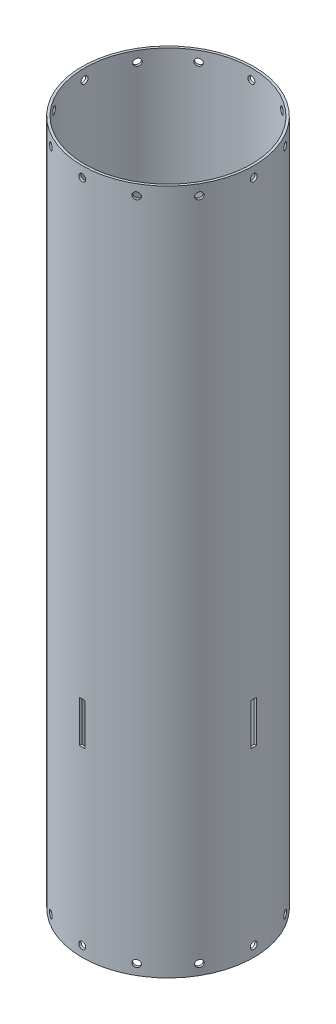
from build123d import *

# Parameters (mm, degrees)
SKETCH1_R           = 78.359
SKETCH1_R_2         = 76.2
BOSS_EXTRUDE1_DEPTH = 626.11
SKETCH2_R           = 3.175
CUT_EXTRUDE1_DEPTH  = 636.841173456
CIRPATTERN1_COUNT   = 12
SKETCH3_W           = 5.08
SKETCH3_H           = 38.1
CUT_EXTRUDE2_DEPTH  = 636.841173579
CIRPATTERN2_COUNT   = 4


with BuildPart() as part:
    # Sketch1 → Boss-Extrude1 (new body)
    with BuildSketch(Plane(origin=(0, 0, 0), x_dir=(1, 0, 0), z_dir=(0, 1, 0))):
        Circle(SKETCH1_R)
        Circle(SKETCH1_R_2, mode=Mode.SUBTRACT)
    extrude(amount=BOSS_EXTRUDE1_DEPTH)

    # Sketch2 → Cut-Extrude1 (cut, through all)
    with BuildSketch(Plane.XY):
        with Locations((0, 9.525)):
            Circle(SKETCH2_R)
        with Locations((0, 616.585)):
            Circle(SKETCH2_R)
    cut_extrude1 = extrude(amount=-CUT_EXTRUDE1_DEPTH, mode=Mode.SUBTRACT)

    # CirPattern1: Cut-Extrude1 ×12 about axis
    cirpattern1_axis = Axis((0, 0, 0), (0, 1, 0))
    for i in range(1, CIRPATTERN1_COUNT):
        add(cut_extrude1.rotate(cirpattern1_axis, i * 360 / CIRPATTERN1_COUNT), mode=Mode.SUBTRACT)

    # Sketch3 → Cut-Extrude2 (cut, through all)
    with BuildSketch(Plane.XY):
        with Locations((0, 185.42)):
            Rectangle(SKETCH3_W, SKETCH3_H)
    cut_extrude2 = extrude(amount=-CUT_EXTRUDE2_DEPTH, mode=Mode.SUBTRACT)

    # CirPattern2: Cut-Extrude2 ×4 about axis
    cirpattern2_axis = Axis((0, 626.11, 0), (0, -1, 0))
    for i in range(1, CIRPATTERN2_COUNT):
        add(cut_extrude2.rotate(cirpattern2_axis, i * 360 / CIRPATTERN2_COUNT), mode=Mode.SUBTRACT)


solid = part.part
